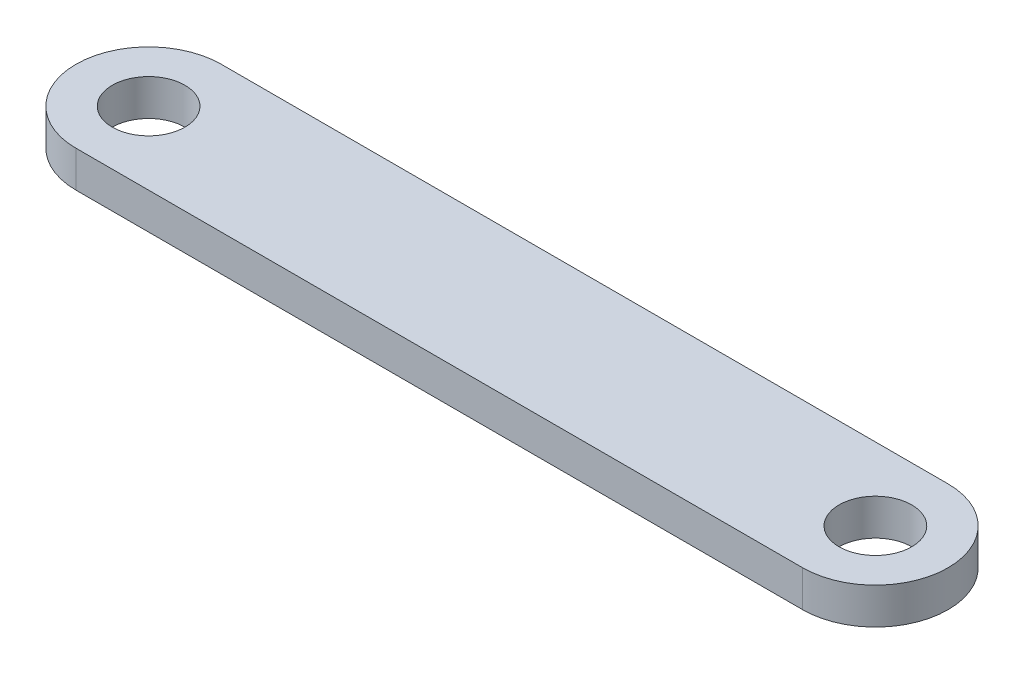
from build123d import *

# Parameters (mm, degrees)
SKETCH1_R           = 5
BOSS_EXTRUDE1_DEPTH = 5


with BuildPart() as part:
    # Sketch1 → Boss-Extrude1 (new body)
    with BuildSketch(Plane(origin=(0, 0, 0), x_dir=(1, 0, 0), z_dir=(0, 1, 0))):
        with BuildLine():
            Line((-50, 10), (50, 10))
            ThreePointArc((50, 10), (60, 0), (50, -10))
            Line((50, -10), (-50, -10))
            ThreePointArc((-50, -10), (-60, 0), (-50, 10))
        make_face()
        with Locations((-50, 0)):
            Circle(SKETCH1_R, mode=Mode.SUBTRACT)
        with Locations((50, 0)):
            Circle(SKETCH1_R, mode=Mode.SUBTRACT)
    extrude(amount=BOSS_EXTRUDE1_DEPTH)


solid = part.part
